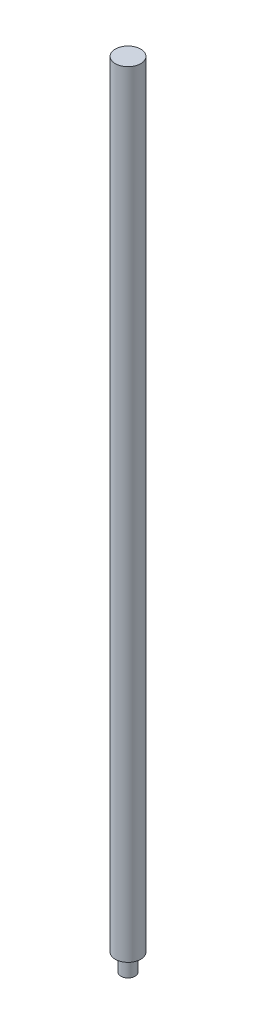
from build123d import *

# Parameters (mm, degrees)
SKETCH_1_R          = 8
EXTRUDE_1_DEPTH     = 500
SKETCH_2_OUTSIDE_W  = 118.102
SKETCH_2_OUTSIDE_H  = 118.102
SKETCH_2_OUTSIDE_R  = 4.5
CUT_EXTRUDE_1_DEPTH = 11


with BuildPart() as part:
    # 草图1 → 凸台-拉伸1 (new body)
    with BuildSketch(Plane(origin=(0, 0, 0), x_dir=(1, 0, 0), z_dir=(0, 1, 0))):
        Circle(SKETCH_1_R)
    extrude(amount=EXTRUDE_1_DEPTH)

    # 草图2 outside → 切除-拉伸1 (cut)
    with BuildSketch(Plane.XZ):
        Rectangle(SKETCH_2_OUTSIDE_W, SKETCH_2_OUTSIDE_H)
        Circle(SKETCH_2_OUTSIDE_R, mode=Mode.SUBTRACT)
    extrude(amount=-CUT_EXTRUDE_1_DEPTH, mode=Mode.SUBTRACT)


solid = part.part
